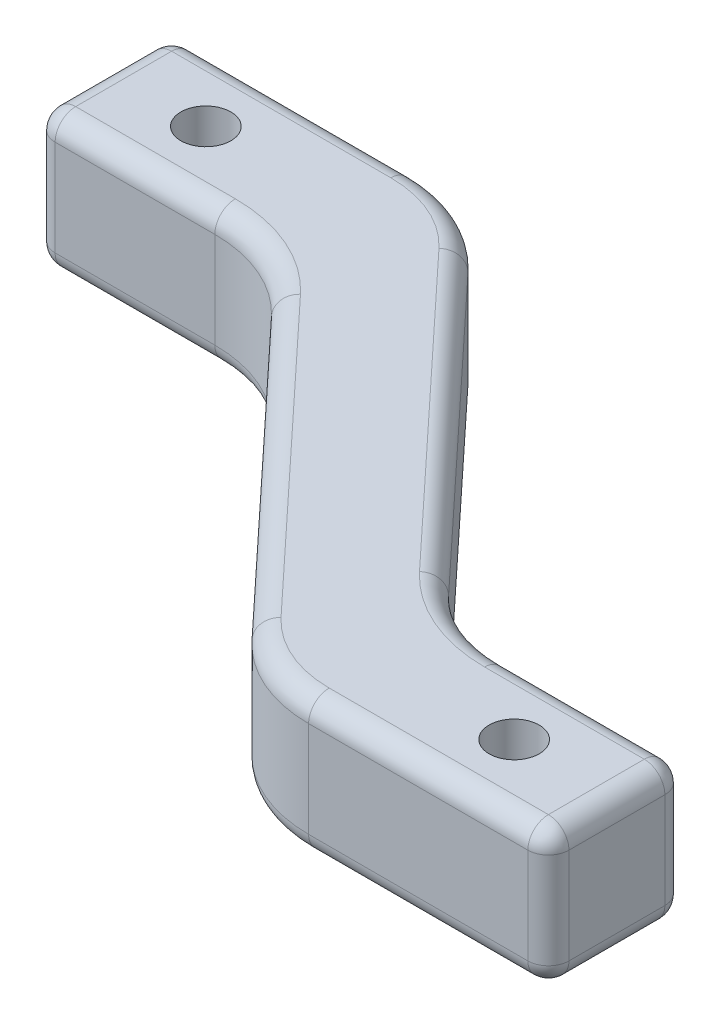
from build123d import *

# Parameters (mm, degrees)
CROQUIS1_R              = 3.65
SALIENTE_EXTRUIR1_DEPTH = 20
REDONDEO1_R             = 20
REDONDEO2_R             = 3


with BuildPart() as part:
    # Croquis1 → Saliente-Extruir1 (new body)
    with BuildSketch(Plane(origin=(0, 0, 0), x_dir=(1, 0, 0), z_dir=(0, 1, 0))):
        Polygon((-65, 0), (-21.305768696, 0), (30, -55), (65, -55), (65, -75), (21.305768696, -75), (-30, -20), (-65, -20), align=None)
        with Locations((-50, -10)):
            Circle(CROQUIS1_R, mode=Mode.SUBTRACT)
        with Locations((50, -65)):
            Circle(CROQUIS1_R, mode=Mode.SUBTRACT)
    extrude(amount=SALIENTE_EXTRUIR1_DEPTH)

    # Redondeo1
    redondeo1_edges = [part.edges().sort_by_distance(p)[0] for p in [
        (21.305768696, 10, 75),
        (30, 10, 55),
        (-21.305768696, 10, 0),
        (-30, 10, 20),
    ]]
    fillet(redondeo1_edges, radius=REDONDEO1_R)

    # Redondeo2
    redondeo2_edges = [part.edges().sort_by_distance(p)[0] for p in [
        (-4.347115652, 0, 47.5),
        (-30.720804996, 0, 21.658122427),
        (4.347115652, 0, 27.5),
        (22.026573691, 0, 73.341877573),
        (-4.347115652, 20, 47.5),
        (-30.720804996, 20, 21.658122427),
        (-51.847115652, 0, 20),
        (-22.026573691, 0, 1.658122427),
        (30.720804996, 0, 53.341877573),
        (47.5, 0, 75),
        (22.026573691, 20, 73.341877573),
        (-65, 10, 20),
        (-51.847115652, 20, 20),
        (-65, 0, 10),
        (-47.5, 0, 0),
        (51.847115652, 0, 55),
        (65, 0, 65),
        (65, 10, 75),
        (47.5, 20, 75),
        (-65, 20, 10),
        (-65, 10, 0),
        (65, 10, 55),
        (65, 20, 65),
        (-47.5, 20, 0),
        (51.847115652, 20, 55),
        (-22.026573691, 20, 1.658122427),
        (30.720804996, 20, 53.341877573),
        (4.347115652, 20, 27.5),
    ]]
    fillet(redondeo2_edges, radius=REDONDEO2_R)


solid = part.part
